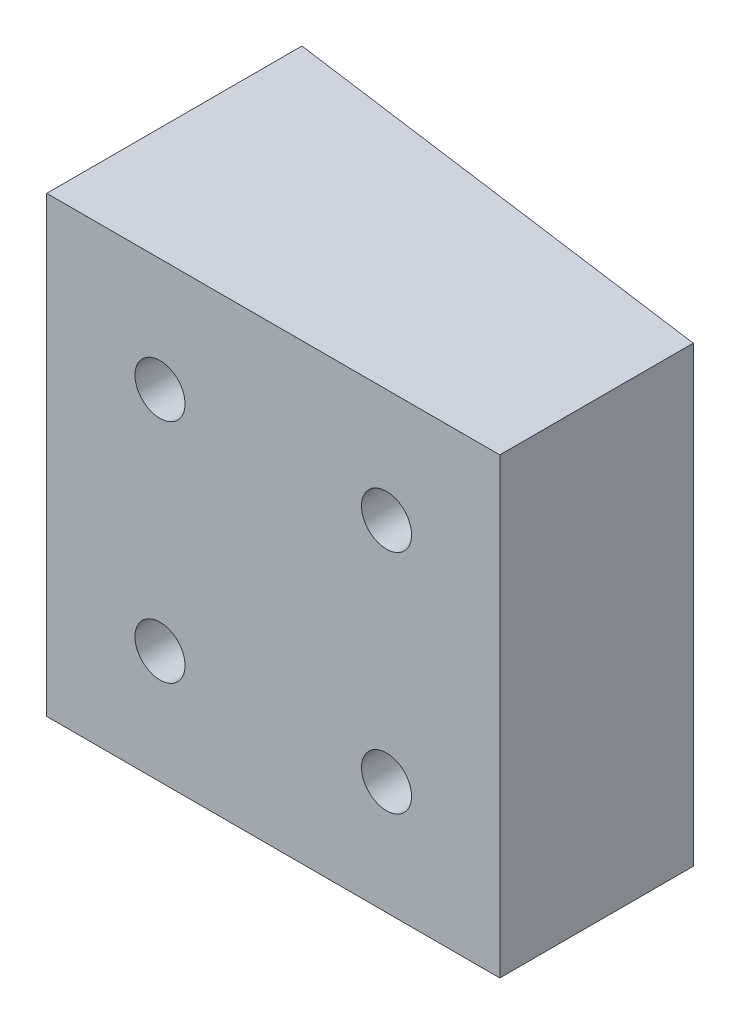
from build123d import *

# Parameters (mm, degrees)
BOSS_EXTRUDE1_DEPTH                                = 50.8
CSK_FOR_10_FLAT_HEAD_MACHINE_SCREW_100_D           = 5.6134
CSK_FOR_10_FLAT_HEAD_MACHINE_SCREW_100_CSINK_D     = 17.78
CSK_FOR_10_FLAT_HEAD_MACHINE_SCREW_100_CSINK_ANGLE = 90
CSK_FOR_10_FLAT_HEAD_MACHINE_SCREW_2_D             = 5.6134
CSK_FOR_10_FLAT_HEAD_MACHINE_SCREW_2_CSINK_D       = 17.78
CSK_FOR_10_FLAT_HEAD_MACHINE_SCREW_2_CSINK_ANGLE   = 90


with BuildPart() as part:
    # Sketch1 → Boss-Extrude1 (new body)
    with BuildSketch(Plane(origin=(0, 0, 0), x_dir=(1, 0, 0), z_dir=(0, 1, 0))):
        Polygon((0, 0), (50.8, 0), (50.8, 21.694374822), (0, 28.609796996), align=None)
    extrude(amount=BOSS_EXTRUDE1_DEPTH)

    # CSK for _10 Flat Head Machine Screw _100 (through all)
    with Locations(Plane(origin=(320.741972913, -316.395089466, -35.56), x_dir=(1, 0, 0), z_dir=(0, 0, -1))):
        with Locations((-308.041854918, -227.495089466), (-308.041854918, -252.895089466), (-308.041972913, -329.095089466), (-308.041972913, -354.495089466)):
            CounterSinkHole(CSK_FOR_10_FLAT_HEAD_MACHINE_SCREW_100_D / 2, CSK_FOR_10_FLAT_HEAD_MACHINE_SCREW_100_CSINK_D / 2, counter_sink_angle=CSK_FOR_10_FLAT_HEAD_MACHINE_SCREW_100_CSINK_ANGLE)

    # CSK for _10 Flat Head Machine Screw  2 (through all)
    with Locations(Plane(origin=(320.741972913, -316.395089466, -33.02), x_dir=(1, 0, 0), z_dir=(0, 0, -1))):
        with Locations((-282.641854918, -227.495089466), (-282.641854918, -252.895089466), (-282.641972913, -329.095089466), (-282.641972913, -354.495089466)):
            CounterSinkHole(CSK_FOR_10_FLAT_HEAD_MACHINE_SCREW_2_D / 2, CSK_FOR_10_FLAT_HEAD_MACHINE_SCREW_2_CSINK_D / 2, counter_sink_angle=CSK_FOR_10_FLAT_HEAD_MACHINE_SCREW_2_CSINK_ANGLE)


solid = part.part
